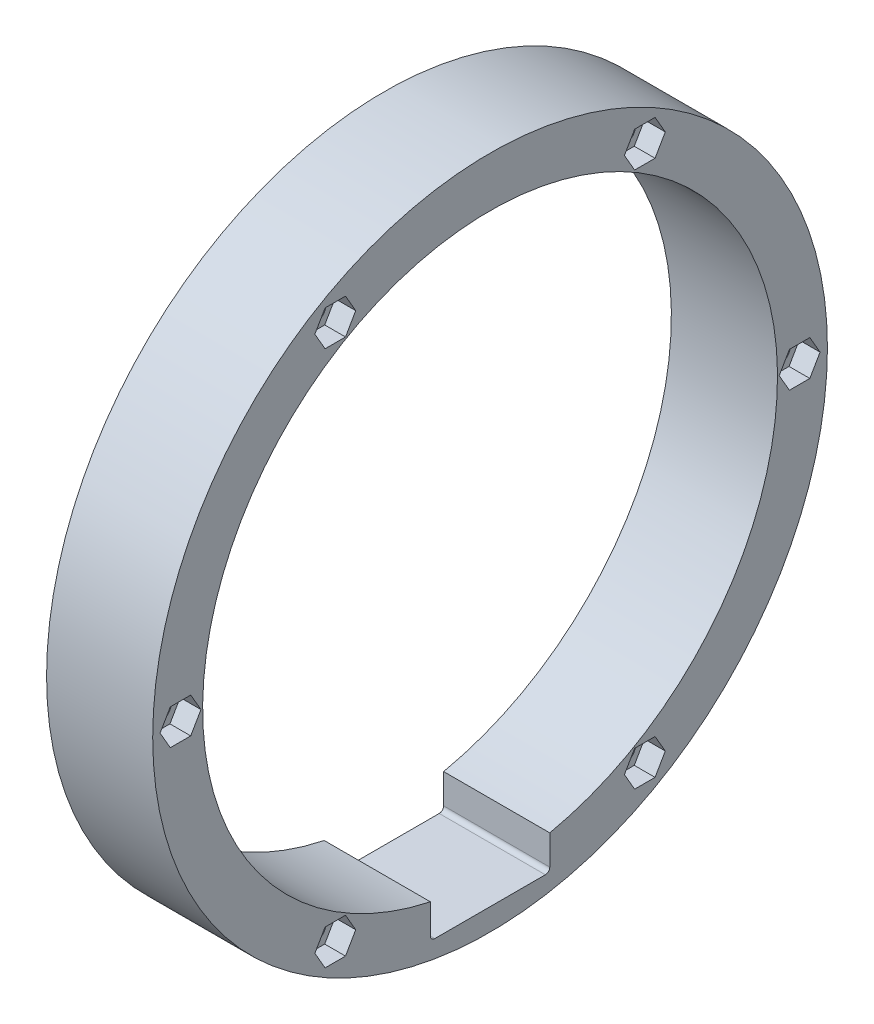
from build123d import *

# Parameters (mm, degrees)
SKETCH1_R           = 76.29
SKETCH1_R_2         = 65
BOSS_EXTRUDE1_DEPTH = 24
CUT_EXTRUDE1_REACH  = 112.527
CUT_EXTRUDE2_REACH  = 112.527
SKETCH3_R           = 2.65
CUT_EXTRUDE3_DEPTH  = 4.7


with BuildPart() as part:
    # Sketch1 → Boss-Extrude1 (new body)
    with BuildSketch(Plane(origin=(0, 0, 0), x_dir=(0, 0, -1), z_dir=(1, 0, 0))):
        Circle(SKETCH1_R)
        Circle(SKETCH1_R_2, mode=Mode.SUBTRACT)
    extrude(amount=BOSS_EXTRUDE1_DEPTH)

    # Sketch2 → Cut-Extrude1 (cut, up to next)
    with BuildSketch(Plane(origin=(24, 0, 0), x_dir=(0, 0, -1), z_dir=(1, 0, 0)), mode=Mode.PRIVATE) as cut_extrude1_sk1:
        with BuildLine():
            Line((-13.5, -51.893967527), (13.5, -51.893967527))
            Line((13.5, -51.893967527), (13.5, -70.29))
            ThreePointArc((13.5, -70.29), (13.207106781, -70.997106781), (12.5, -71.29))
            Line((12.5, -71.29), (-12.5, -71.29))
            ThreePointArc((-12.5, -71.29), (-13.207106781, -70.997106781), (-13.5, -70.29))
            Line((-13.5, -70.29), (-13.5, -51.893967527))
        make_face()
    cut_extrude1_tool1 = extrude(cut_extrude1_sk1.sketch, amount=-CUT_EXTRUDE1_REACH, mode=Mode.PRIVATE) & part.part
    add(cut_extrude1_tool1.solids().sort_by_distance((24, -61.584212, 0))[0], mode=Mode.SUBTRACT)

    # Sketch3 → Cut-Extrude2 (cut, up to next)
    with BuildSketch(Plane(origin=(24, 0, 0), x_dir=(0, 0, -1), z_dir=(1, 0, 0)), mode=Mode.PRIVATE) as cut_extrude2_sk1:
        with Locations((-70, 0)):
            Circle(SKETCH3_R)
    cut_extrude2_tool1 = extrude(cut_extrude2_sk1.sketch, amount=-CUT_EXTRUDE2_REACH, mode=Mode.PRIVATE) & part.part
    # Sketch3 → Cut-Extrude2 (cut, up to next)
    with BuildSketch(Plane(origin=(24, 0, 0), x_dir=(0, 0, -1), z_dir=(1, 0, 0)), mode=Mode.PRIVATE) as cut_extrude2_sk2:
        with Locations((-35, 60.621778265)):
            Circle(SKETCH3_R)
    cut_extrude2_tool2 = extrude(cut_extrude2_sk2.sketch, amount=-CUT_EXTRUDE2_REACH, mode=Mode.PRIVATE) & part.part
    # Sketch3 → Cut-Extrude2 (cut, up to next)
    with BuildSketch(Plane(origin=(24, 0, 0), x_dir=(0, 0, -1), z_dir=(1, 0, 0)), mode=Mode.PRIVATE) as cut_extrude2_sk3:
        with Locations((35, 60.621778265)):
            Circle(SKETCH3_R)
    cut_extrude2_tool3 = extrude(cut_extrude2_sk3.sketch, amount=-CUT_EXTRUDE2_REACH, mode=Mode.PRIVATE) & part.part
    # Sketch3 → Cut-Extrude2 (cut, up to next)
    with BuildSketch(Plane(origin=(24, 0, 0), x_dir=(0, 0, -1), z_dir=(1, 0, 0)), mode=Mode.PRIVATE) as cut_extrude2_sk4:
        with Locations((70, 0)):
            Circle(SKETCH3_R)
    cut_extrude2_tool4 = extrude(cut_extrude2_sk4.sketch, amount=-CUT_EXTRUDE2_REACH, mode=Mode.PRIVATE) & part.part
    # Sketch3 → Cut-Extrude2 (cut, up to next)
    with BuildSketch(Plane(origin=(24, 0, 0), x_dir=(0, 0, -1), z_dir=(1, 0, 0)), mode=Mode.PRIVATE) as cut_extrude2_sk5:
        with Locations((35, -60.621778265)):
            Circle(SKETCH3_R)
    cut_extrude2_tool5 = extrude(cut_extrude2_sk5.sketch, amount=-CUT_EXTRUDE2_REACH, mode=Mode.PRIVATE) & part.part
    # Sketch3 → Cut-Extrude2 (cut, up to next)
    with BuildSketch(Plane(origin=(24, 0, 0), x_dir=(0, 0, -1), z_dir=(1, 0, 0)), mode=Mode.PRIVATE) as cut_extrude2_sk6:
        with Locations((-35, -60.621778265)):
            Circle(SKETCH3_R)
    cut_extrude2_tool6 = extrude(cut_extrude2_sk6.sketch, amount=-CUT_EXTRUDE2_REACH, mode=Mode.PRIVATE) & part.part
    add(cut_extrude2_tool1.solids().sort_by_distance((24, 0, 70))[0], mode=Mode.SUBTRACT)
    add(cut_extrude2_tool2.solids().sort_by_distance((24, 60.621778, 35))[0], mode=Mode.SUBTRACT)
    add(cut_extrude2_tool3.solids().sort_by_distance((24, 60.621778, -35))[0], mode=Mode.SUBTRACT)
    add(cut_extrude2_tool4.solids().sort_by_distance((24, 0, -70))[0], mode=Mode.SUBTRACT)
    add(cut_extrude2_tool5.solids().sort_by_distance((24, -60.621778, -35))[0], mode=Mode.SUBTRACT)
    add(cut_extrude2_tool6.solids().sort_by_distance((24, -60.621778, 35))[0], mode=Mode.SUBTRACT)

    # Sketch4 → Cut-Extrude3 (cut)
    with BuildSketch(Plane(origin=(24, 0, 0), x_dir=(0, 0, -1), z_dir=(1, 0, 0))):
        Polygon((-37.309401077, 56.621778265), (-32.690598923, 56.621778265), (-30.381197846, 60.621778265), (-32.690598923, 64.621778265), (-37.309401077, 64.621778265), (-39.618802154, 60.621778265), align=None)
        Polygon((-67.690598923, -4), (-65.381197846, 0), (-67.690598923, 4), (-72.309401077, 4), (-74.618802154, 0), (-72.309401077, -4), align=None)
        Polygon((30.381197846, 60.621778265), (32.690598923, 56.621778265), (37.309401077, 56.621778265), (39.618802154, 60.621778265), (37.309401077, 64.621778265), (32.690598923, 64.621778265), align=None)
        Polygon((67.690598923, 4), (65.381197846, 0), (67.690598923, -4), (72.309401077, -4), (74.618802154, 0), (72.309401077, 4), align=None)
        Polygon((37.309401077, -56.621778265), (32.690598923, -56.621778265), (30.381197846, -60.621778265), (32.690598923, -64.621778265), (37.309401077, -64.621778265), (39.618802154, -60.621778265), align=None)
        Polygon((-30.381197846, -60.621778265), (-32.690598923, -56.621778265), (-37.309401077, -56.621778265), (-39.618802154, -60.621778265), (-37.309401077, -64.621778265), (-32.690598923, -64.621778265), align=None)
    extrude(amount=-CUT_EXTRUDE3_DEPTH, mode=Mode.SUBTRACT)


solid = part.part
